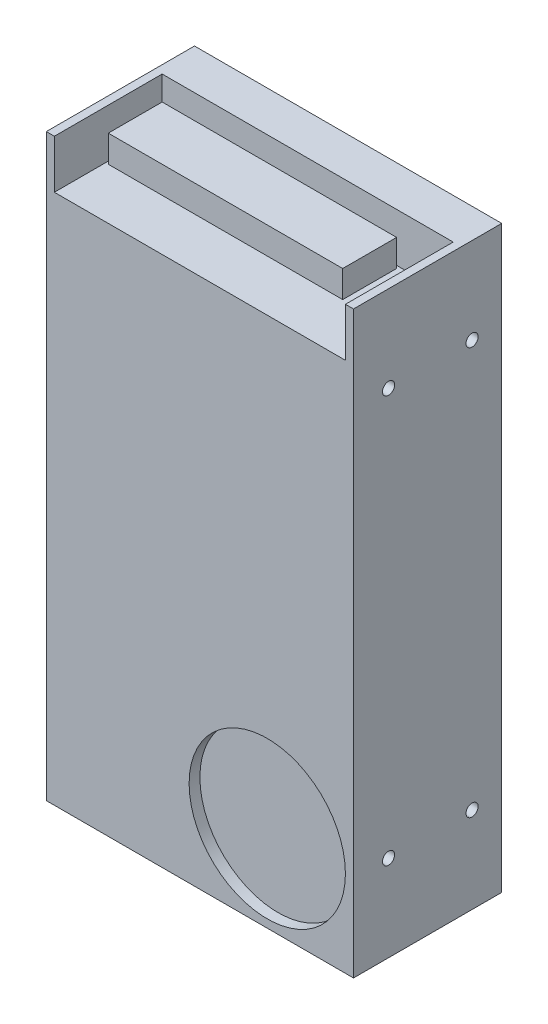
from build123d import *

# Parameters (mm, degrees)
SKETCH1_W           = 114
SKETCH1_H           = 215
BOSS_EXTRUDE1_DEPTH = 55
SKETCH2_W           = 108
SKETCH2_H           = 18
CUT_EXTRUDE1_DEPTH  = 40
SKETCH3_W           = 87
SKETCH3_H           = 20
BOSS_EXTRUDE2_DEPTH = 10
SKETCH4_R           = 29
CUT_EXTRUDE3_DEPTH  = 4
SKETCH5_R           = 2.25
CUT_EXTRUDE4_DEPTH  = 15
SKETCH6_R           = 2.25
CUT_EXTRUDE5_DEPTH  = 167.063993689


with BuildPart() as part:
    # Sketch1 → Boss-Extrude1 (new body)
    with BuildSketch(Plane.XY):
        Rectangle(SKETCH1_W, SKETCH1_H)
    extrude(amount=BOSS_EXTRUDE1_DEPTH)

    # Sketch2 → Cut-Extrude1 (cut)
    with BuildSketch(Plane.XY.offset(55)):
        with Locations((0, 98.5)):
            Rectangle(SKETCH2_W, SKETCH2_H)
    extrude(amount=-CUT_EXTRUDE1_DEPTH, mode=Mode.SUBTRACT)

    # Sketch3 → Boss-Extrude2 (add)
    with BuildSketch(Plane(origin=(0, 89.5, 0), x_dir=(1, 0, 0), z_dir=(0, 1, 0))):
        with Locations((-9.5, -26)):
            Rectangle(SKETCH3_W, SKETCH3_H)
    extrude(amount=BOSS_EXTRUDE2_DEPTH)

    # Sketch4 → Cut-Extrude3 (cut)
    with BuildSketch(Plane.XY.offset(55)):
        with Locations((25, -75.5)):
            Circle(SKETCH4_R)
    extrude(amount=-CUT_EXTRUDE3_DEPTH, mode=Mode.SUBTRACT)

    # Sketch5 → Cut-Extrude4 (cut)
    with BuildSketch(Plane(origin=(0, 0, 0), x_dir=(-1, 0, 0), z_dir=(0, 0, -1))):
        with Locations((-25, 75.5)):
            Circle(SKETCH5_R)
        with Locations((25, 75.5)):
            Circle(SKETCH5_R)
        with Locations((25, -75.5)):
            Circle(SKETCH5_R)
        with Locations((-25, -75.5)):
            Circle(SKETCH5_R)
    extrude(amount=-CUT_EXTRUDE4_DEPTH, mode=Mode.SUBTRACT)

    # Sketch6 → Cut-Extrude5 (cut, through all)
    with BuildSketch(Plane.ZY.offset(57)):
        with Locations((11, 75.5)):
            Circle(SKETCH6_R)
        with Locations((42, 75.5)):
            Circle(SKETCH6_R)
        with Locations((42, -75.5)):
            Circle(SKETCH6_R)
        with Locations((11, -75.5)):
            Circle(SKETCH6_R)
    extrude(amount=-CUT_EXTRUDE5_DEPTH, mode=Mode.SUBTRACT)


solid = part.part
